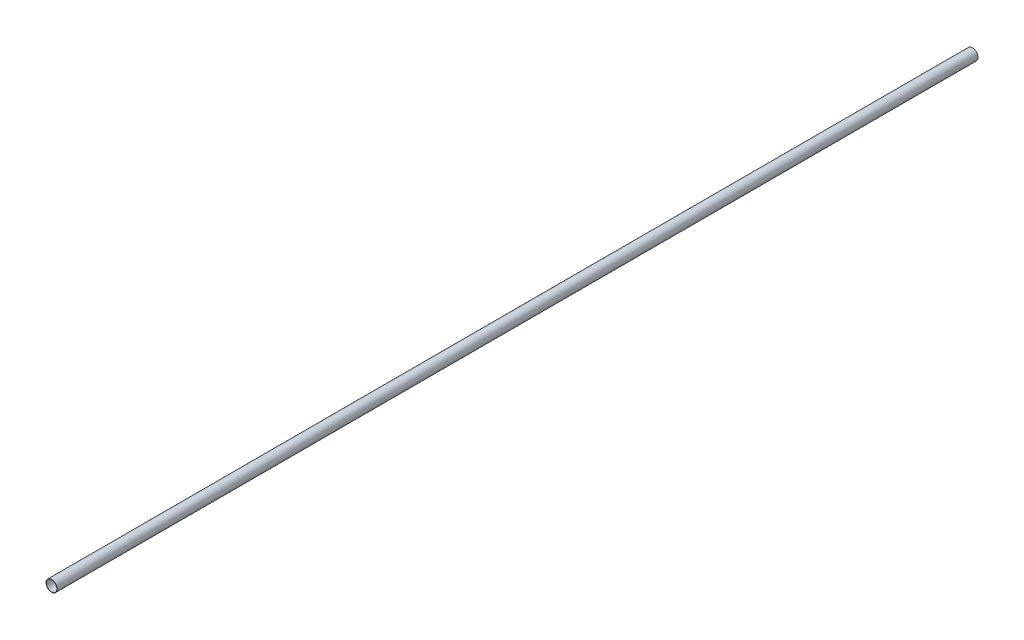
from build123d import *

# Parameters (mm, degrees)
SKETCH1_R           = 4.572
SKETCH1_R_2         = 4.318
BOSS_EXTRUDE1_DEPTH = 755.65


with BuildPart() as part:
    # Sketch1 → Boss-Extrude1 (new body)
    with BuildSketch(Plane.XY):
        with Locations((-112.420066819, -112.420066819)):
            Circle(SKETCH1_R)
        with Locations((-112.420066819, -112.420066819)):
            Circle(SKETCH1_R_2, mode=Mode.SUBTRACT)
    extrude(amount=BOSS_EXTRUDE1_DEPTH)


solid = part.part
